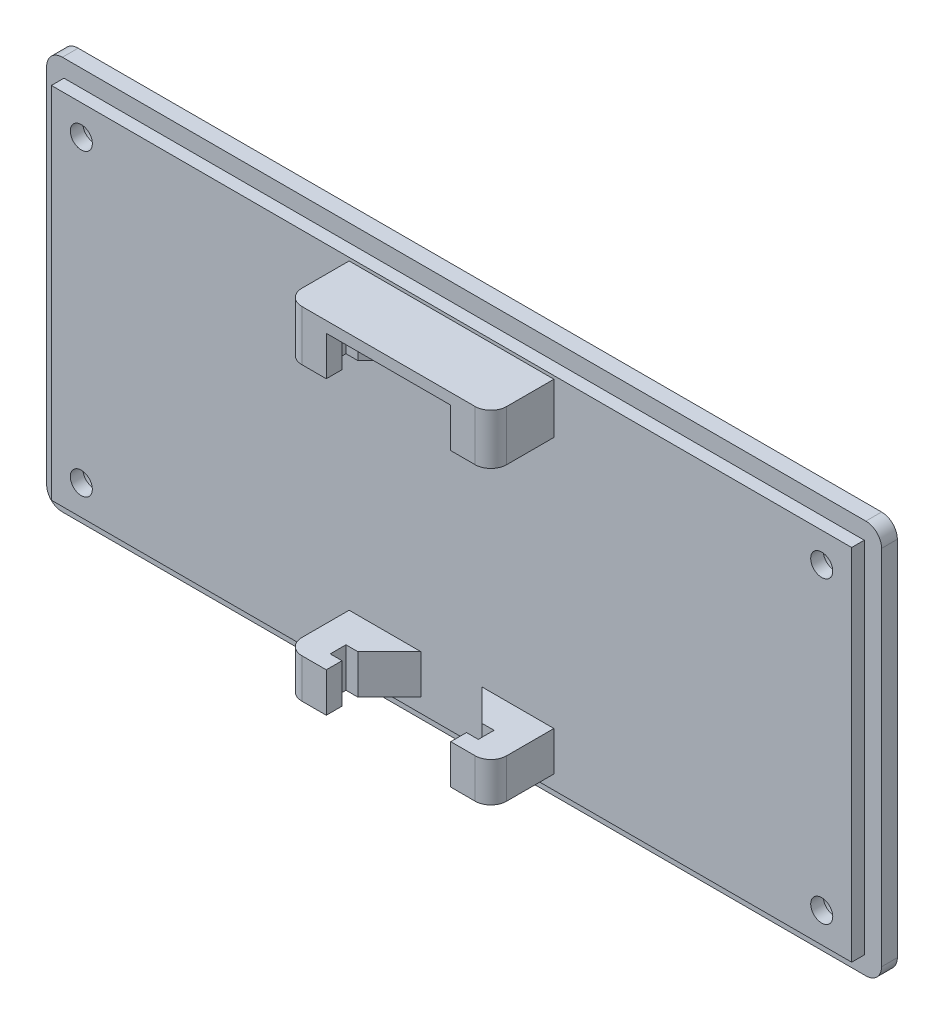
from build123d import *

# Parameters (mm, degrees)
SKETCH_1_W                     = 106
SKETCH_1_H                     = 50
BODY_DEPTH                     = 2
SKETCH_2_W                     = 101.6
SKETCH_2_H                     = 45.6
INTERNALBODY_DEPTH             = 1.6
SKETCH_3_R                     = 1.4
HOLESCREW_DEPTH                = 59.710816721
SKETCH_3_3_R                   = 2.5
SKETCH_3_3_R_2                 = 1.4
TOPSCREWPLACE_DEPTH            = 2
SCREWMIRROR2_COPY_1_SKETCH_R   = 1.4
SCREWMIRROR2_COPY_1_DEPTH      = 59.710816721
SCREWMIRROR2_COPY_2_SKETCH_R   = 2.5
SCREWMIRROR2_COPY_2_SKETCH_R_2 = 1.4
SCREWMIRROR2_COPY_2_DEPTH      = 2
CORNERS_R                      = 2
SKETCH_4_W                     = 26
SKETCH_4_H                     = 1.4
ARDUINONANOSTOPS_DEPTH         = 8
ARDUINONANOHOLDER1_DEPTH       = 5
PATTERN_LINEAR_1_COUNT         = 2
PATTERN_LINEAR_1_PITCH         = 37
CHAMFER_1_SIZE                 = 4
FILLET_1_R                     = 2


with BuildPart() as part:
    # Эскиз1 → Body (new body)
    with BuildSketch(Plane.XY):
        Rectangle(SKETCH_1_W, SKETCH_1_H)
    extrude(amount=BODY_DEPTH)

    # Эскиз2 → InternalBody (add)
    with BuildSketch(Plane.XY.offset(2)):
        Rectangle(SKETCH_2_W, SKETCH_2_H)
    extrude(amount=INTERNALBODY_DEPTH)

    # Эскиз3 → HoleScrew (cut, through all)
    with BuildSketch(Plane(origin=(0, 0, 0), x_dir=(-1, 0, 0), z_dir=(0, 0, -1))):
        with Locations((47, -19)):
            Circle(SKETCH_3_R)
    holescrew = extrude(amount=-HOLESCREW_DEPTH, mode=Mode.SUBTRACT)

    # Эскиз3<3> → TopScrewPlace (cut)
    with BuildSketch(Plane(origin=(0, 0, 0), x_dir=(-1, 0, 0), z_dir=(0, 0, -1))):
        with Locations((47, -19)):
            Circle(SKETCH_3_3_R)
        with Locations((47, -19)):
            Circle(SKETCH_3_3_R_2, mode=Mode.SUBTRACT)
    topscrewplace = extrude(amount=-TOPSCREWPLACE_DEPTH, mode=Mode.SUBTRACT)

    # ScrewMrror1: HoleScrew, TopScrewPlace across plane
    add(holescrew.mirror(Plane.ZX), mode=Mode.SUBTRACT)
    add(topscrewplace.mirror(Plane.ZX), mode=Mode.SUBTRACT)

    # ScrewMirror2: HoleScrew, TopScrewPlace across plane
    add(holescrew.mirror(Plane(origin=(0, 0, 0), x_dir=(0, 0, 1), z_dir=(1, 0, 0))), mode=Mode.SUBTRACT)
    add(topscrewplace.mirror(Plane(origin=(0, 0, 0), x_dir=(0, 0, 1), z_dir=(1, 0, 0))), mode=Mode.SUBTRACT)

    # ScrewMirror2 copy 1 sketch → ScrewMirror2 copy 1 (cut, through all)
    with BuildSketch(Plane(origin=(0, 0, 0), x_dir=(1, 0, 0), z_dir=(0, 0, -1))):
        with Locations((47, -19)):
            Circle(SCREWMIRROR2_COPY_1_SKETCH_R)
    extrude(amount=-SCREWMIRROR2_COPY_1_DEPTH, mode=Mode.SUBTRACT)

    # ScrewMirror2 copy 2 sketch → ScrewMirror2 copy 2 (cut)
    with BuildSketch(Plane(origin=(0, 0, 0), x_dir=(1, 0, 0), z_dir=(0, 0, -1))):
        with Locations((47, -19)):
            Circle(SCREWMIRROR2_COPY_2_SKETCH_R)
        with Locations((47, -19)):
            Circle(SCREWMIRROR2_COPY_2_SKETCH_R_2, mode=Mode.SUBTRACT)
    extrude(amount=-SCREWMIRROR2_COPY_2_DEPTH, mode=Mode.SUBTRACT)

    # Corners
    corners_edges = [part.edges().sort_by_distance(p)[0] for p in [
        (53, -25, 1),
        (-53, -25, 1),
        (-53, 25, 1),
        (53, 25, 1),
    ]]
    fillet(corners_edges, radius=CORNERS_R)

    # Эскиз4 → ArduinoNanoStops (add)
    with BuildSketch(Plane.XY.offset(3.6)):
        with Locations((0, 21.7)):
            Rectangle(SKETCH_4_W, SKETCH_4_H)
    extrude(amount=ARDUINONANOSTOPS_DEPTH)

    # Эскиз5 → ArduinoNanoHolder1 (add)
    with BuildSketch(Plane.XZ.offset(-21)):
        Polygon((-7.9, 11.6), (-7.9, 9.6), (-9.4, 9.6), (-9.4, 7.6), (-7.9, 7.6), (-7.9, 3.6), (-13, 3.6), (-13, 11.6), align=None)
        Polygon((7.9, 11.6), (7.9, 9.6), (9.4, 9.6), (9.4, 7.6), (7.9, 7.6), (7.9, 3.6), (13, 3.6), (13, 11.6), align=None)
    arduinonanoholder1 = extrude(amount=ARDUINONANOHOLDER1_DEPTH)

    # Линейный массив1: ArduinoNanoHolder1 ×2
    with Locations(*[(0, -i * PATTERN_LINEAR_1_PITCH, 0) for i in range(1, PATTERN_LINEAR_1_COUNT)]):
        add(arduinonanoholder1)

    # Фаска1
    chamfer_1_edges = [part.edges().sort_by_distance(p)[0] for p in [
        (7.9, 18.5, 3.6),
        (7.9, -18.5, 3.6),
        (-7.9, -18.5, 3.6),
        (-7.9, 18.5, 3.6),
    ]]
    chamfer(chamfer_1_edges, length=CHAMFER_1_SIZE - 0.0001)  # a hair under: the kernel refuses the full size

    # Скругление1
    fillet_1_edges = [part.edges().sort_by_distance(p)[0] for p in [
        (-13, 19.2, 11.6),
        (13, 19.2, 11.6),
        (-13, -18.5, 11.6),
        (13, -18.5, 11.6),
    ]]
    fillet(fillet_1_edges, radius=FILLET_1_R)


solid = part.part
